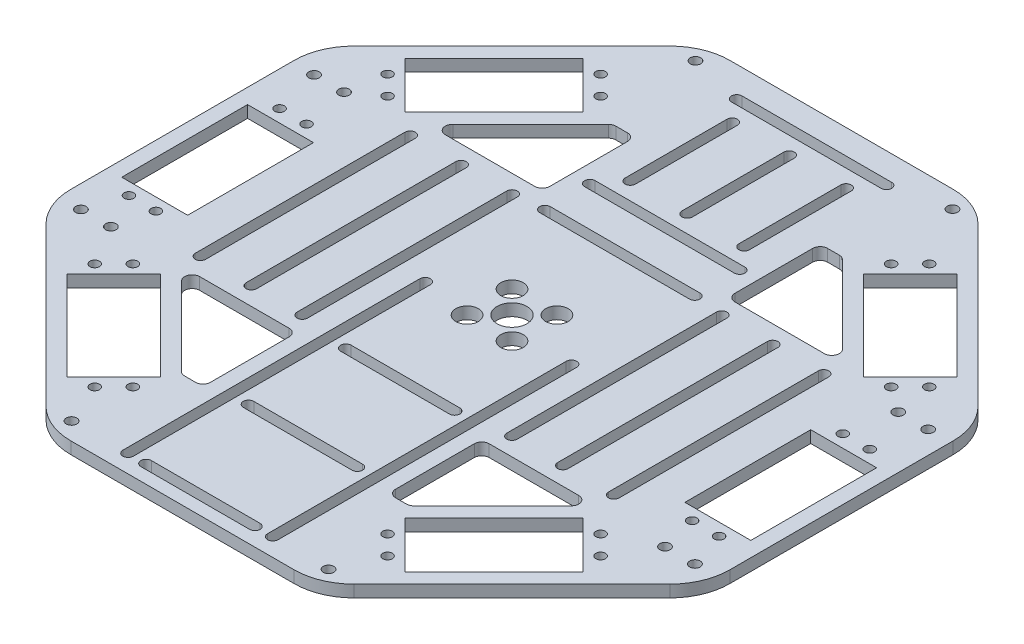
from build123d import *

# Parameters (mm, degrees)
BASEPLATE_DEPTH          = 4
FILLET1_R                = 20
SKETCH2_W                = 22
SKETCH2_H                = 42
SKETCH2_R                = 1.6
SERVO_HOLE_DEPTH         = 156.614909311
SKETCH3_R                = 5
CENTER_HOLE_DEPTH        = 156.614909311
SERVO_HOLE_PATTERN_COUNT = 8
MIRROR1_COPY_1_SKETCH_W  = 22
MIRROR1_COPY_1_SKETCH_H  = 42
MIRROR1_COPY_1_SKETCH_R  = 1.6
MIRROR1_COPY_1_DEPTH     = 156.614909311
MIRROR1_COPY_2_SKETCH_W  = 22
MIRROR1_COPY_2_SKETCH_H  = 42
MIRROR1_COPY_2_SKETCH_R  = 1.6
MIRROR1_COPY_2_DEPTH     = 156.614909311
SLITS_DEPTH              = 156.614909311
CUT_EXTRUDE1_DEPTH       = 156.614909311
SKETCH7_R                = 1.75
CUT_EXTRUDE2_DEPTH       = 10
SKETCH8_R                = 3.75
CUT_EXTRUDE3_DEPTH       = 10
CUT_EXTRUDE4_DEPTH       = 156.614909311
FILLET2_R                = 2.5
FILLET2_OF_MIRROR3_R     = 2.5


with BuildPart() as part:
    # Sketch1 → Baseplate (new body)
    with BuildSketch(Plane(origin=(0, 0, 0), x_dir=(1, 0, 0), z_dir=(0, 1, 0))):
        Polygon((-110, 45.563491861), (-110, -45.563491861), (-45.563491861, -110), (45.563491861, -110), (110, -45.563491861), (110, 45.563491861), (45.563491861, 110), (-45.563491861, 110), align=None)
    extrude(amount=BASEPLATE_DEPTH)

    # Fillet1
    fillet1_edges = [part.edges().sort_by_distance(p)[0] for p in [
        (-110, 2, -45.563491861),
        (-45.563491861, 2, -110),
        (45.563491861, 2, -110),
        (110, 2, -45.563491861),
        (110, 2, 45.563491861),
        (45.563491861, 2, 110),
        (-45.563491861, 2, 110),
        (-110, 2, 45.563491861),
    ]]
    fillet(fillet1_edges, radius=FILLET1_R)

    # Sketch2 → Servo hole (cut, through all)
    with BuildSketch(Plane(origin=(0, 4, 0), x_dir=(1, 0, 0), z_dir=(0, 1, 0))):
        with Locations((94, -4.279220614)):
            Rectangle(SKETCH2_W, SKETCH2_H)
        with Locations((98.5, 20.920779386)):
            Circle(SKETCH2_R)
        with Locations((89.5, 20.920779386)):
            Circle(SKETCH2_R)
        with Locations((89.5, -29.379220614)):
            Circle(SKETCH2_R)
        with Locations((98.5, -29.379220614)):
            Circle(SKETCH2_R)
    servo_hole = extrude(amount=-SERVO_HOLE_DEPTH, mode=Mode.SUBTRACT)

    # Sketch3 → Center hole (cut, through all)
    with BuildSketch(Plane(origin=(0, 4, 0), x_dir=(1, 0, 0), z_dir=(0, 1, 0))):
        Circle(SKETCH3_R)
    extrude(amount=-CENTER_HOLE_DEPTH, mode=Mode.SUBTRACT)

    # Servo hole pattern: Servo hole ×8 about axis, 5 skipped
    servo_hole_pattern_axis = Axis((0, 4, 0), (0, 1, 0))
    add([servo_hole.rotate(servo_hole_pattern_axis, i * 360 / SERVO_HOLE_PATTERN_COUNT) for i in range(1, SERVO_HOLE_PATTERN_COUNT) if i not in (2, 3, 4, 5, 6)], mode=Mode.SUBTRACT)

    # Mirror1: Servo hole across plane
    add(servo_hole.mirror(Plane(origin=(0, 0, 0), x_dir=(0, 0, 1), z_dir=(1, 0, 0))), mode=Mode.SUBTRACT)

    # Mirror1 copy 1 sketch → Mirror1 copy 1 (cut, through all)
    with BuildSketch(Plane(origin=(0, 4, 0), x_dir=(-0.7071067811865476, 0, -0.7071067811865475), z_dir=(0, 1, 0))):
        with Locations((94, 4.279220614)):
            Rectangle(MIRROR1_COPY_1_SKETCH_W, MIRROR1_COPY_1_SKETCH_H)
        with Locations((98.5, -20.920779386)):
            Circle(MIRROR1_COPY_1_SKETCH_R)
        with Locations((89.5, -20.920779386)):
            Circle(MIRROR1_COPY_1_SKETCH_R)
        with Locations((89.5, 29.379220614)):
            Circle(MIRROR1_COPY_1_SKETCH_R)
        with Locations((98.5, 29.379220614)):
            Circle(MIRROR1_COPY_1_SKETCH_R)
    extrude(amount=-MIRROR1_COPY_1_DEPTH, mode=Mode.SUBTRACT)

    # Mirror1 copy 2 sketch → Mirror1 copy 2 (cut, through all)
    with BuildSketch(Plane(origin=(0, 4, 0), x_dir=(-0.7071067811865474, 0, 0.7071067811865477), z_dir=(0, 1, 0))):
        with Locations((94, 4.279220614)):
            Rectangle(MIRROR1_COPY_2_SKETCH_W, MIRROR1_COPY_2_SKETCH_H)
        with Locations((98.5, -20.920779386)):
            Circle(MIRROR1_COPY_2_SKETCH_R)
        with Locations((89.5, -20.920779386)):
            Circle(MIRROR1_COPY_2_SKETCH_R)
        with Locations((89.5, 29.379220614)):
            Circle(MIRROR1_COPY_2_SKETCH_R)
        with Locations((98.5, 29.379220614)):
            Circle(MIRROR1_COPY_2_SKETCH_R)
    extrude(amount=-MIRROR1_COPY_2_DEPTH, mode=Mode.SUBTRACT)

    # Sketch5 → Slits (cut, through all)
    with BuildSketch(Plane(origin=(0, 4, 0), x_dir=(1, 0, 0), z_dir=(0, 1, 0))):
        with BuildLine():
            Line((25, 37.75), (-25, 37.75))
            ThreePointArc((-25, 37.75), (-26.75, 36), (-25, 34.25))
            Line((-25, 34.25), (25, 34.25))
            ThreePointArc((25, 34.25), (26.75, 36), (25, 37.75))
        make_face()
        with BuildLine():
            Line((25, 52.75), (-25, 52.75))
            ThreePointArc((-25, 52.75), (-26.75, 51), (-25, 49.25))
            Line((-25, 49.25), (25, 49.25))
            ThreePointArc((25, 49.25), (26.75, 51), (25, 52.75))
        make_face()
        with BuildLine():
            Line((-50.25, -35), (-50.25, 35))
            ThreePointArc((-50.25, 35), (-52, 36.75), (-53.75, 35))
            Line((-53.75, 35), (-53.75, -35))
            ThreePointArc((-53.75, -35), (-52, -36.75), (-50.25, -35))
        make_face()
        with BuildLine():
            Line((-33.25, -35), (-33.25, 35))
            ThreePointArc((-33.25, 35), (-35, 36.75), (-36.75, 35))
            Line((-36.75, 35), (-36.75, -35))
            ThreePointArc((-36.75, -35), (-35, -36.75), (-33.25, -35))
        make_face()
        with BuildLine():
            Line((36.75, -35), (36.75, 35))
            ThreePointArc((36.75, 35), (35, 36.75), (33.25, 35))
            Line((33.25, 35), (33.25, -35))
            ThreePointArc((33.25, -35), (35, -36.75), (36.75, -35))
        make_face()
        with BuildLine():
            Line((53.75, -35), (53.75, 35))
            ThreePointArc((53.75, 35), (52, 36.75), (50.25, 35))
            Line((50.25, 35), (50.25, -35))
            ThreePointArc((50.25, -35), (52, -36.75), (53.75, -35))
        make_face()
        with BuildLine():
            Line((25, 101.75), (-25, 101.75))
            ThreePointArc((-25, 101.75), (-26.75, 100), (-25, 98.25))
            Line((-25, 98.25), (25, 98.25))
            ThreePointArc((25, 98.25), (26.75, 100), (25, 101.75))
        make_face()
        with BuildLine():
            Line((-17.25, 58.5), (-17.25, 92.5))
            ThreePointArc((-17.25, 92.5), (-19, 94.25), (-20.75, 92.5))
            Line((-20.75, 92.5), (-20.75, 58.5))
            ThreePointArc((-20.75, 58.5), (-19, 56.75), (-17.25, 58.5))
        make_face()
        with BuildLine():
            Line((20.75, 58.5), (20.75, 92.5))
            ThreePointArc((20.75, 92.5), (19, 94.25), (17.25, 92.5))
            Line((17.25, 92.5), (17.25, 58.5))
            ThreePointArc((17.25, 58.5), (19, 56.75), (20.75, 58.5))
        make_face()
        with BuildLine():
            Line((1.75, 58.5), (1.75, 92.5))
            ThreePointArc((1.75, 92.5), (0, 94.25), (-1.75, 92.5))
            Line((-1.75, 92.5), (-1.75, 58.5))
            ThreePointArc((-1.75, 58.5), (0, 56.75), (1.75, 58.5))
        make_face()
        with BuildLine():
            Line((-67.25, -35), (-67.25, 35))
            ThreePointArc((-67.25, 35), (-69, 36.75), (-70.75, 35))
            Line((-70.75, 35), (-70.75, -35))
            ThreePointArc((-70.75, -35), (-69, -36.75), (-67.25, -35))
        make_face()
        with BuildLine():
            Line((70.75, -35), (70.75, 35))
            ThreePointArc((70.75, 35), (69, 36.75), (67.25, 35))
            Line((67.25, 35), (67.25, -35))
            ThreePointArc((67.25, -35), (69, -36.75), (70.75, -35))
        make_face()
    extrude(amount=-SLITS_DEPTH, mode=Mode.SUBTRACT)

    # Sketch6 → Cut-Extrude1 (cut, through all)
    with BuildSketch(Plane(origin=(0, 4, 0), x_dir=(1, 0, 0), z_dir=(0, 1, 0))):
        with BuildLine():
            Line((25.9, -104), (25.9, -4.31189896))
            ThreePointArc((25.9, -4.31189896), (24.15, -2.56189896), (22.4, -4.31189896))
            Line((22.4, -4.31189896), (22.4, -104))
            ThreePointArc((22.4, -104), (24.15, -105.75), (25.9, -104))
        make_face()
        with BuildLine():
            Line((-25.9, -4.855098268), (-25.9, -104))
            ThreePointArc((-25.9, -104), (-24.15, -105.75), (-22.4, -104))
            Line((-22.4, -104), (-22.4, -4.855098268))
            ThreePointArc((-22.4, -4.855098268), (-24.15, -3.105098268), (-25.9, -4.855098268))
        make_face()
        with BuildLine():
            Line((18.15, -35.55), (-18.15, -35.55))
            ThreePointArc((-18.15, -35.55), (-19.9, -37.3), (-18.15, -39.05))
            Line((-18.15, -39.05), (18.15, -39.05))
            ThreePointArc((18.15, -39.05), (19.9, -37.3), (18.15, -35.55))
        make_face()
        with BuildLine():
            Line((18.15, -102.25), (-18.15, -102.25))
            ThreePointArc((-18.15, -102.25), (-19.9, -104), (-18.15, -105.75))
            Line((-18.15, -105.75), (18.15, -105.75))
            ThreePointArc((18.15, -105.75), (19.9, -104), (18.15, -102.25))
        make_face()
        with BuildLine():
            Line((18.15, -68.037745573), (-18.15, -68.037745573))
            ThreePointArc((-18.15, -68.037745573), (-19.9, -69.787745573), (-18.15, -71.537745573))
            Line((-18.15, -71.537745573), (18.15, -71.537745573))
            ThreePointArc((18.15, -71.537745573), (19.9, -69.787745573), (18.15, -68.037745573))
        make_face()
    extrude(amount=-CUT_EXTRUDE1_DEPTH, mode=Mode.SUBTRACT)

    # Sketch7 → Cut-Extrude2 (cut)
    with BuildSketch(Plane(origin=(0, 4, 0), x_dir=(1, 0, 0), z_dir=(0, 1, 0))):
        with Locations((-102.5, 36.421356237)):
            Circle(SKETCH7_R)
        with Locations((-92.5, 36.421356237)):
            Circle(SKETCH7_R)
        with Locations((-92.5, -41.421356237)):
            Circle(SKETCH7_R)
        with Locations((-102.5, -41.421356237)):
            Circle(SKETCH7_R)
        with Locations((-42.9, -104.142135624)):
            Circle(SKETCH7_R)
        with Locations((-42.9, 104.142135624)):
            Circle(SKETCH7_R)
    cut_extrude2 = extrude(amount=-CUT_EXTRUDE2_DEPTH, mode=Mode.SUBTRACT)

    # Mirror2: Cut-Extrude2 across plane
    add(cut_extrude2.mirror(Plane.ZY), mode=Mode.SUBTRACT)

    # Sketch8 → Cut-Extrude3 (cut)
    with BuildSketch(Plane(origin=(0, 4, 0), x_dir=(1, 0, 0), z_dir=(0, 1, 0))):
        with Locations((-7.5, 7.5)):
            Circle(SKETCH8_R)
        with Locations((7.5, 7.5)):
            Circle(SKETCH8_R)
        with Locations((-7.5, -7.5)):
            Circle(SKETCH8_R)
        with Locations((7.5, -7.5)):
            Circle(SKETCH8_R)
    extrude(amount=-CUT_EXTRUDE3_DEPTH, mode=Mode.SUBTRACT)

    # Sketch9 → Cut-Extrude4 (cut, through all)
    with BuildSketch(Plane(origin=(0, 4, 0), x_dir=(1, 0, 0), z_dir=(0, 1, 0))):
        Polygon((-69.308657865, -41), (-38.055465508, -72.253192357), (-30.9, -72.253192357), (-30.9, -41), align=None)
        Polygon((-69.308657865, 41), (-38.347312677, 71.961345188), (-30.9, 71.961345188), (-30.9, 41), align=None)
    cut_extrude4 = extrude(amount=-CUT_EXTRUDE4_DEPTH, mode=Mode.SUBTRACT)

    # Fillet2
    fillet2_edges = [part.edges().sort_by_distance(p)[0] for p in [
        (-30.9, 2, 41),
        (-69.308657865, 2, 41),
        (-38.055465508, 2, 72.253192357),
        (-30.9, 2, 72.253192357),
        (-30.9, 2, -41),
        (-38.347312677, 2, -71.961345188),
        (-30.9, 2, -71.961345188),
        (-69.308657865, 2, -41),
    ]]
    fillet(fillet2_edges, radius=FILLET2_R)

    # Mirror3: Cut-Extrude4 across plane
    add(cut_extrude4.mirror(Plane.ZY), mode=Mode.SUBTRACT)

    # Fillet2 of Mirror3
    fillet2_of_mirror3_edges = [part.edges().sort_by_distance(p)[0] for p in [
        (30.9, 2, 41),
        (69.308657865, 2, 41),
        (38.055465508, 2, 72.253192357),
        (30.9, 2, 72.253192357),
        (30.9, 2, -41),
        (38.347312677, 2, -71.961345188),
        (30.9, 2, -71.961345188),
        (69.308657865, 2, -41),
    ]]
    fillet(fillet2_of_mirror3_edges, radius=FILLET2_OF_MIRROR3_R)


solid = part.part
